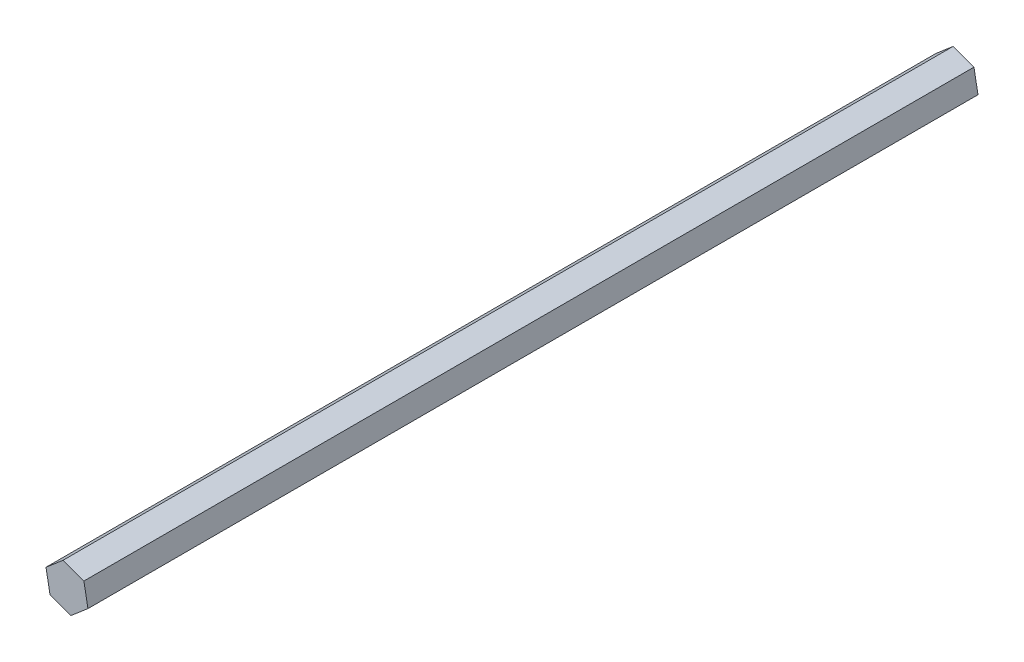
from build123d import *

# Parameters (mm, degrees)
BOSS_EXTRUDE1_DEPTH = 160


with BuildPart() as part:
    # Sketch1 → Boss-Extrude1 (new body)
    with BuildSketch(Plane.XY):
        Polygon((3.770690633, -1.334875333), (3.041381265, 2.598076211), (-0.729309367, 3.932951544), (-3.770690633, 1.334875333), (-3.041381265, -2.598076211), (0.729309367, -3.932951544), align=None)
    extrude(amount=BOSS_EXTRUDE1_DEPTH)


solid = part.part
